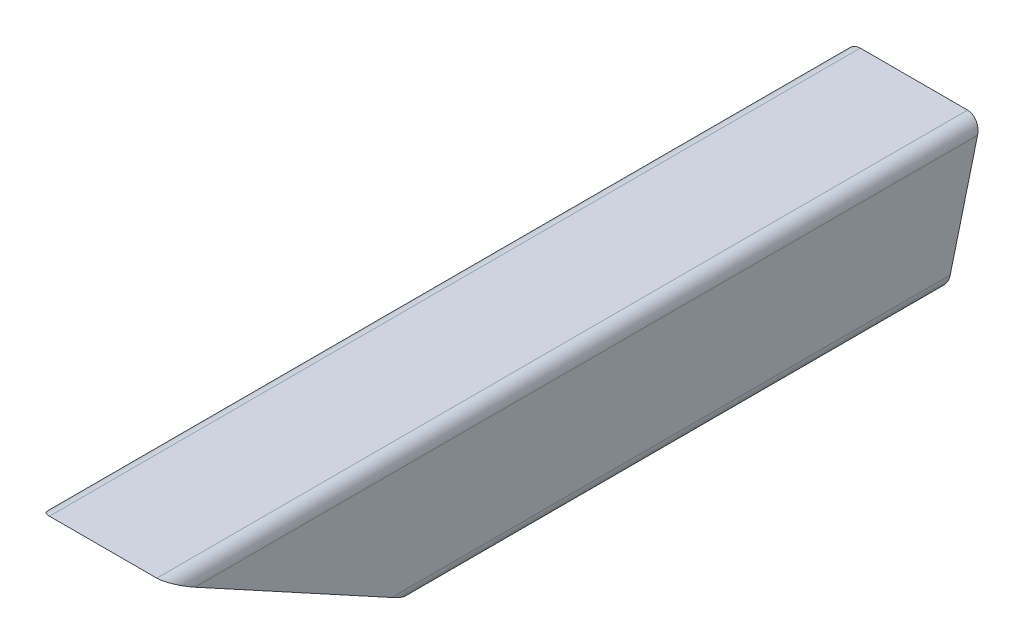
from build123d import *

# Parameters (mm, degrees)
EXTRUDE_START         = -216.432140614
EXTRUDE_2_DEPTH       = 216.432140614
EXTRUDE_START_2       = -214
EXTRUDE_2_2_OUTLINE_W = 32
EXTRUDE_2_2_OUTLINE_H = 33
EXTRUDE_2_2_DEPTH     = 7.978792001
CUT_EXTRUDE_1_DEPTH   = 220.015687774


with BuildPart() as part:
    # Бобышка-Вытянуть2: read off the stored shape, not the designer's step
    # Бобышка-Вытянуть2 outline → Бобышка-Вытянуть2 (new body)
    with BuildSketch(Plane.XY.offset(EXTRUDE_START)):
        with BuildLine():
            Line((-30, 12), (-30, -12))
            ThreePointArc((-30, -12), (-29.121320344, -14.121320344), (-27, -15))
            Line((-27, -15), (-3, -15))
            ThreePointArc((-3, -15), (-0.878679656, -14.121320344), (0, -12))
            Line((0, -12), (0, 12))
            ThreePointArc((0, 12), (-0.878679656, 14.121320344), (-3, 15))
            Line((-3, 15), (-27, 15))
            ThreePointArc((-27, 15), (-29.121320344, 14.121320344), (-30, 12))
        make_face()
        with BuildLine():
            ThreePointArc((-26, -13), (-27.414213562, -12.414213562), (-28, -11))
            Line((-28, -11), (-28, 11))
            ThreePointArc((-28, 11), (-27.414213562, 12.414213562), (-26, 13))
            Line((-26, 13), (-4, 13))
            ThreePointArc((-4, 13), (-2.585786438, 12.414213562), (-2, 11))
            Line((-2, 11), (-2, -11))
            ThreePointArc((-2, -11), (-2.585786438, -12.414213562), (-4, -13))
            Line((-4, -13), (-26, -13))
        make_face(mode=Mode.SUBTRACT)
    extrude(amount=EXTRUDE_2_DEPTH)

    # Extrude 2 2 outline → Extrude 2 2 (cut)
    with BuildSketch(Plane(origin=(0, 0, 0), x_dir=(1, 0, 0), z_dir=(0, 0.24699838348974407, 0.9690158917961322)).offset(EXTRUDE_START_2)):
        with Locations((-15, 52.5)):
            Rectangle(EXTRUDE_2_2_OUTLINE_W, EXTRUDE_2_2_OUTLINE_H)
    extrude(amount=EXTRUDE_2_2_DEPTH, mode=Mode.SUBTRACT)

    # Эскиз2 → Вырез-Вытянуть1 (cut, through all)
    with BuildSketch(Plane(origin=(0, 0, 0), x_dir=(0, 0, -1), z_dir=(1, 0, 0))):
        Polygon((-3.198950411, 35.913322267), (90.182976942, -15), (69.518016438, -52.902335865), (-23.863910916, -1.989013598), align=None)
    extrude(amount=-CUT_EXTRUDE_1_DEPTH, mode=Mode.SUBTRACT)


solid = part.part
